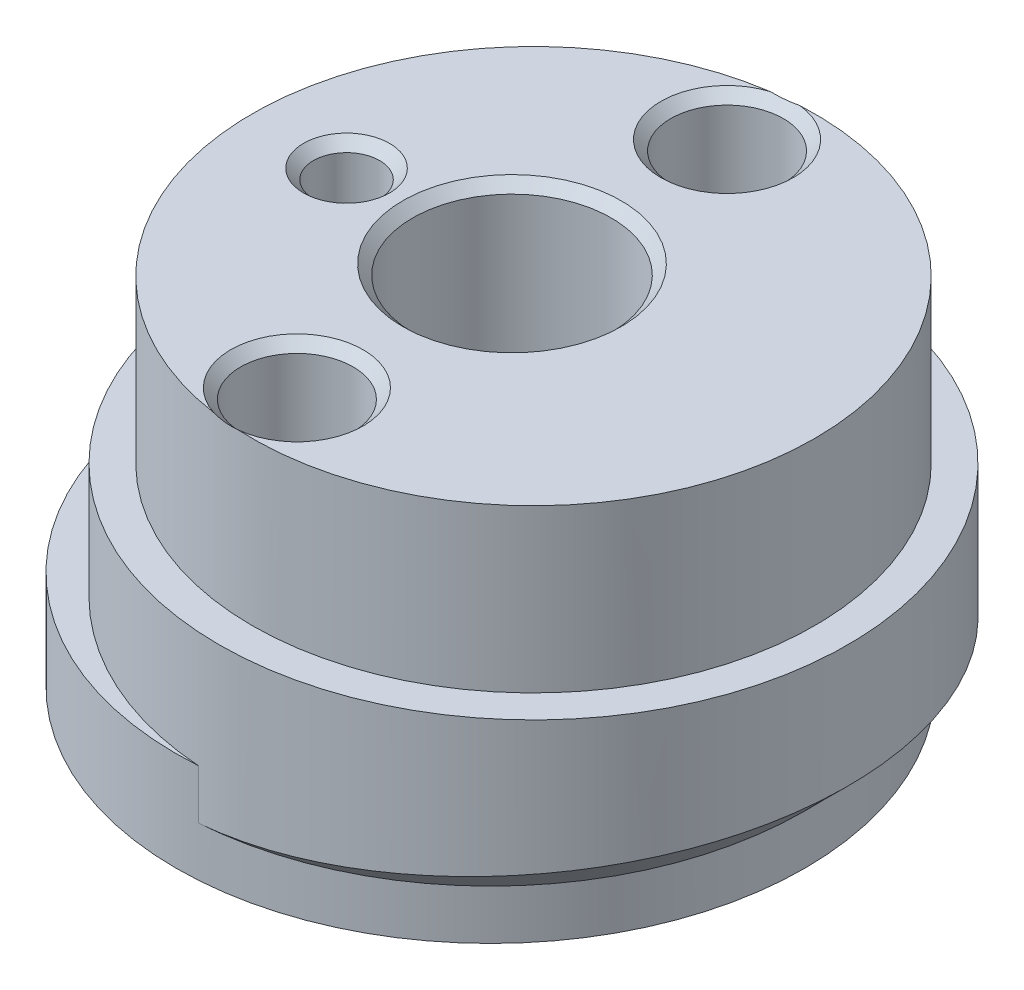
from build123d import *

# Parameters (mm, degrees)
SKETCH1_R            = 9.5
SKETCH1_R_2          = 3
BOSS_EXTRUDE1_DEPTH  = 3
SKETCH7_R            = 8.5
SKETCH7_R_2          = 3
BOSS_EXTRUDE5_DEPTH  = 8.4
SKETCH8_R            = 9.5
SKETCH8_R_2          = 8.5
BOSS_EXTRUDE6_DEPTH  = 3.5
CHAMFER1_SIZE        = 1.5
SKETCH12_R           = 3
SKETCH12_R_2         = 1
CUT_EXTRUDE4_DEPTH   = 18.978668035
M3_CLEARANCE_HOLE1_D = 3.4
CHAMFER2_SIZE        = 0.3


with BuildPart() as part:
    # Sketch1 → Boss-Extrude1 (new body)
    with BuildSketch(Plane(origin=(0, 0, 0), x_dir=(1, 0, 0), z_dir=(0, 1, 0))):
        with Locations(Location((-0.65, 0, 0), (0, 0, 270))):
            Circle(SKETCH1_R)
        with Locations(Location((0, 0, 0), (0, 0, 270))):
            Circle(SKETCH1_R_2, mode=Mode.SUBTRACT)
    extrude(amount=BOSS_EXTRUDE1_DEPTH)

    # Sketch7 → Boss-Extrude5 (add)
    with BuildSketch(Plane(origin=(0, 3, 0), x_dir=(1, 0, 0), z_dir=(0, 1, 0))):
        with Locations(Location((0.65, 0, 0), (0, 0, 42.437907805))):
            Circle(SKETCH7_R)
        with Locations(Location((0, 0, 0), (0, 0, 270))):
            Circle(SKETCH7_R_2, mode=Mode.SUBTRACT)
    extrude(amount=BOSS_EXTRUDE5_DEPTH)

    # Sketch8 → Boss-Extrude6 (add)
    with BuildSketch(Plane(origin=(0, 3, 0), x_dir=(1, 0, 0), z_dir=(0, 1, 0))):
        with Locations(Location((0.65, 0, 0), (0, 0, 93.923302734))):
            Circle(SKETCH8_R)
        with Locations(Location((0.65, 0, 0), (0, 0, 270))):
            Circle(SKETCH8_R_2, mode=Mode.SUBTRACT)
    extrude(amount=BOSS_EXTRUDE6_DEPTH)

    # Chamfer1
    # the kernel refuses this chamfer: 1.5 mm, written as the material it adds along each edge
    with BuildSketch(Plane(origin=(-0.65, 3, 0), x_dir=(-0.3317687677714116, 0, -0.9433607394477679), z_dir=(-0.9433607394477679, 0, 0.3317687677714116))) as chamfer1_piece_1_section:
        Polygon((9.5, CHAMFER1_SIZE), (9.5 + CHAMFER1_SIZE, 0), (9.5, 0), align=None)
    chamfer1_piece_1 = revolve(axis=Axis((-0.65, 3, 0), (0, -1, 0)), revolution_arc=218.752335407, mode=Mode.PRIVATE)
    chamfer1_piece_1 = chamfer1_piece_1 & Plane(origin=(0.65, 2.170447869, 0), x_dir=(-0.06842105263614455, 0, -0.9976565338613094), z_dir=(0, -1, 0)) * Cylinder(9.5, 44, mode=Mode.PRIVATE)
    add(chamfer1_piece_1)

    # Sketch12 → Cut-Extrude4 (cut, through all)
    with BuildSketch(Plane(origin=(0, 11.4, 0), x_dir=(1, 0, 0), z_dir=(0, 1, 0))):
        with Locations(Location((0, 0, 0), (0, 0, 270))):
            Circle(SKETCH12_R)
        with Locations(Location((-5, 0, 0), (0, 0, 270))):
            Circle(SKETCH12_R_2)
    extrude(amount=-CUT_EXTRUDE4_DEPTH, mode=Mode.SUBTRACT)

    # M3 Clearance Hole1 (through all)
    with Locations(Plane(origin=(0, 11.4, 0), x_dir=(1, 0, 0), z_dir=(0, 1, 0))):
        with Locations((0, 6.5), (0, -6.5)):
            Hole(M3_CLEARANCE_HOLE1_D / 2)

    # Chamfer2
    # the kernel refuses this chamfer: 0.3 mm, written as the material it takes off along each edge
    with BuildSketch(Plane(origin=(0, 11.4, 0), x_dir=(0, 0, 1), z_dir=(-1, 0, 0))) as chamfer2_piece_1:
        Polygon((3, -CHAMFER2_SIZE), (3 + CHAMFER2_SIZE, 0), (3, 0), align=None)
    revolve(axis=Axis((0, 11.4, 0), (0, 1, 0)), mode=Mode.SUBTRACT)
    with BuildSketch(Plane(origin=(-5, 0, 0), x_dir=(0, 0, 1), z_dir=(-1, 0, 0))) as chamfer2_piece_2:
        Polygon((1 + CHAMFER2_SIZE, 0), (1, CHAMFER2_SIZE), (1, 0), align=None)
    revolve(axis=Axis((-5, 0, 0), (0, 1, 0)), mode=Mode.SUBTRACT)
    with BuildSketch(Plane(origin=(-5, 11.4, 0), x_dir=(0, 0, 1), z_dir=(-1, 0, 0))) as chamfer2_piece_3:
        Polygon((1, -CHAMFER2_SIZE), (1 + CHAMFER2_SIZE, 0), (1, 0), align=None)
    revolve(axis=Axis((-5, 11.4, 0), (0, 1, 0)), mode=Mode.SUBTRACT)
    with BuildSketch(Plane(origin=(0, 0, 0), x_dir=(0, 0, 1), z_dir=(-1, 0, 0))) as chamfer2_piece_4:
        Polygon((3 + CHAMFER2_SIZE, 0), (3, CHAMFER2_SIZE), (3, 0), align=None)
    revolve(axis=Axis((0, 0, 0), (0, 1, 0)), mode=Mode.SUBTRACT)
    with BuildSketch(Plane(origin=(0, 11.4, 6.5), x_dir=(-1, 0, 0), z_dir=(0, 0, 1))) as chamfer2_piece_5:
        Polygon((1.7, CHAMFER2_SIZE), (1.7 + CHAMFER2_SIZE, 0), (1.7, 0), align=None)
    revolve(axis=Axis((0, 11.4, 6.5), (0, -1, 0)), mode=Mode.SUBTRACT)
    with BuildSketch(Plane(origin=(0, 0, 6.5), x_dir=(-1, 0, 0), z_dir=(0, 0, 1))) as chamfer2_piece_6:
        Polygon((1.7 + CHAMFER2_SIZE, 0), (1.7, -CHAMFER2_SIZE), (1.7, 0), align=None)
    revolve(axis=Axis((0, 0, 6.5), (0, -1, 0)), mode=Mode.SUBTRACT)
    with BuildSketch(Plane(origin=(0, 11.4, -6.5), x_dir=(-1, 0, 0), z_dir=(0, 0, 1))) as chamfer2_piece_7:
        Polygon((1.7, CHAMFER2_SIZE), (1.7 + CHAMFER2_SIZE, 0), (1.7, 0), align=None)
    revolve(axis=Axis((0, 11.4, -6.5), (0, -1, 0)), mode=Mode.SUBTRACT)
    with BuildSketch(Plane(origin=(0, 0, -6.5), x_dir=(-1, 0, 0), z_dir=(0, 0, 1))) as chamfer2_piece_8:
        Polygon((1.7 + CHAMFER2_SIZE, 0), (1.7, -CHAMFER2_SIZE), (1.7, 0), align=None)
    revolve(axis=Axis((0, 0, -6.5), (0, -1, 0)), mode=Mode.SUBTRACT)


solid = part.part
